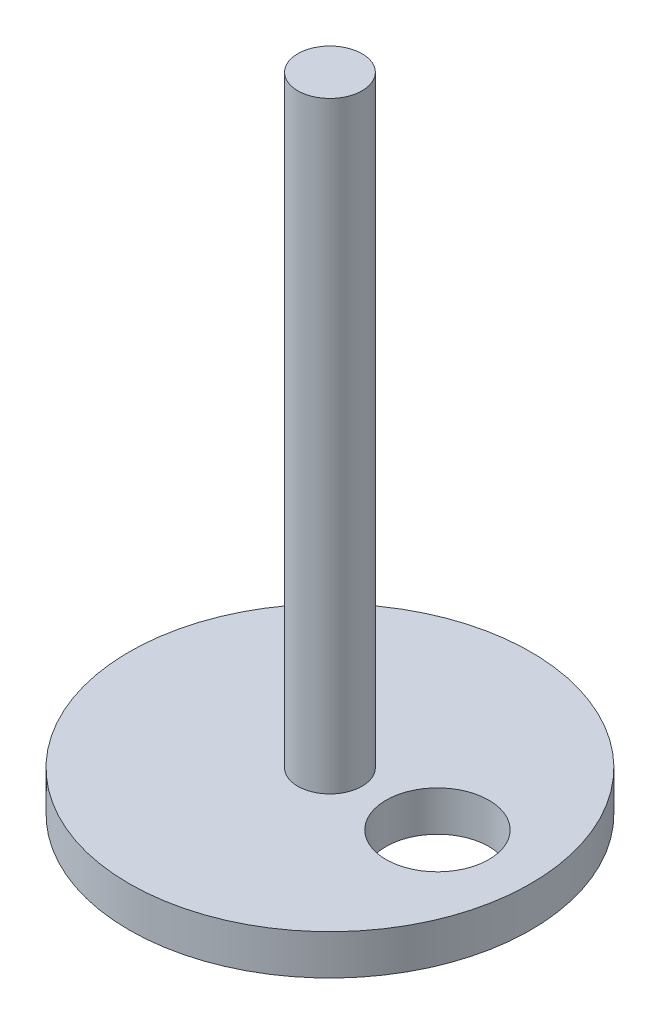
from build123d import *

# Parameters (mm, degrees)
SKETCH1_R           = 50
BOSS_EXTRUDE1_DEPTH = 10
SKETCH2_R           = 8
BOSS_EXTRUDE2_DEPTH = 150
SKETCH3_R           = 12.807098875
CUT_EXTRUDE1_DEPTH  = 10


with BuildPart() as part:
    # Sketch1 → Boss-Extrude1 (new body)
    with BuildSketch(Plane(origin=(0, 0, 0), x_dir=(1, 0, 0), z_dir=(0, 1, 0))):
        Circle(SKETCH1_R)
    extrude(amount=BOSS_EXTRUDE1_DEPTH)

    # Sketch2 → Boss-Extrude2 (add)
    with BuildSketch(Plane(origin=(0, 10, 0), x_dir=(1, 0, 0), z_dir=(0, 1, 0))):
        Circle(SKETCH2_R)
    extrude(amount=BOSS_EXTRUDE2_DEPTH)

    # Sketch3 → Cut-Extrude1 (cut)
    with BuildSketch(Plane.XZ):
        with Locations((26.775331923, 0)):
            Circle(SKETCH3_R)
    extrude(amount=-CUT_EXTRUDE1_DEPTH, mode=Mode.SUBTRACT)


solid = part.part
